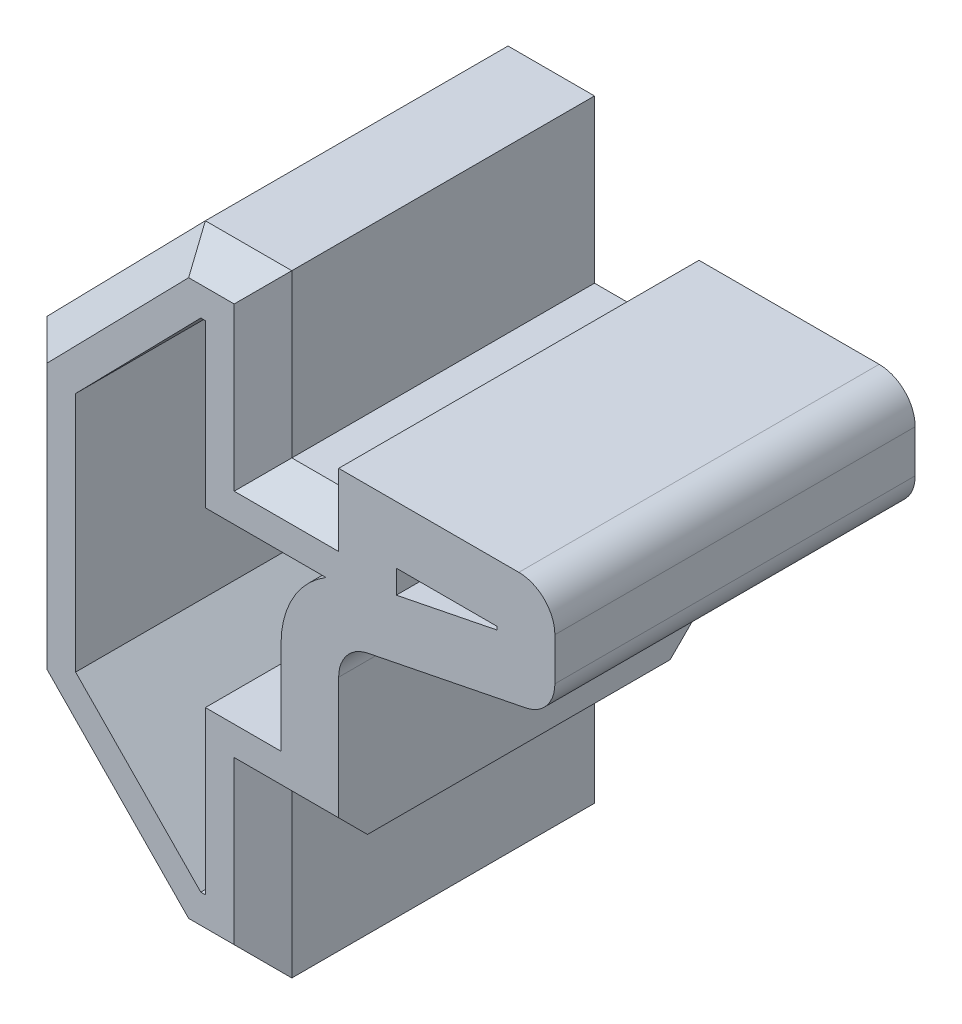
from build123d import *

# Parameters (mm, degrees)
SALIENTE_EXTRUIR1_DEPTH = 5
SALIENTE_EXTRUIR2_DEPTH = 10
REDONDEO1_R             = 1
VACIADO1_START          = -5
VACIADO1_DEPTH          = 10
CHAFL_N1_SIZE           = 0.8


# Read off the part's stored shape, not the designer's step: Vaciado1
with BuildPart() as part:
    # Croquis1 → Saliente-Extruir1 (new, symmetric)
    with BuildSketch(Plane.XY):
        Polygon((0, 4), (-2.1, 4), (-2.1, 8.5), (-4.5, 8.5), (-8.9, 4), (-8.9, -4), (-4.5, -8.5), (-2.1, -8.5), (-2.1, -4), (0, -4), align=None)
    extrude(amount=SALIENTE_EXTRUIR1_DEPTH, both=True)

    # Croquis2 → Saliente-Extruir2 (add, through all)
    with BuildSketch(Plane(origin=(0, 0, -5), x_dir=(-1, 0, 0), z_dir=(0, 0, -1))):
        Polygon((0, 4), (0, 5.2), (-6, 5.2), (-6, 2.2), (0, 1), align=None)
    extrude(amount=-SALIENTE_EXTRUIR2_DEPTH)

    # Redondeo1
    redondeo1_edges = [part.edges().sort_by_distance(p)[0] for p in [
        (0, 1, 0),
        (6, 2.2, 0),
        (6, 5.2, 0),
    ]]
    fillet(redondeo1_edges, radius=REDONDEO1_R)

    # Vaciado1 outline → Vaciado1 (cut)
    with BuildSketch(Plane.XY.offset(VACIADO1_START)):
        Polygon((4.4, 3.511686244), (4.4, 3.6), (1.6, 3.6), (1.6, 2.951686244), align=None)
        with BuildLine():
            Line((-1.6, -2.4), (-1.6, 0.180196097))
            ThreePointArc((-1.6, 0.180196097), (-1.267111406, 1.453069175), (-0.35368779, 2.4))
            Line((-0.35368779, 2.4), (-3.7, 2.4))
            Line((-3.7, 2.4), (-3.7, 6.9))
            Line((-3.7, 6.9), (-3.826703079, 6.9))
            Line((-3.826703079, 6.9), (-7.3, 3.347764512))
            Line((-7.3, 3.347764512), (-7.3, -3.347764512))
            Line((-7.3, -3.347764512), (-3.826703079, -6.9))
            Line((-3.826703079, -6.9), (-3.7, -6.9))
            Line((-3.7, -6.9), (-3.7, -2.4))
            Line((-3.7, -2.4), (-1.6, -2.4))
        make_face()
    extrude(amount=VACIADO1_DEPTH, mode=Mode.SUBTRACT)

    # Chaflán1
    chafl_n1_edges = [part.edges().sort_by_distance(p)[0] for p in [
        (-1.05, -4, -5),
        (-2.1, -6.25, -5),
        (-3.3, -8.5, -5),
        (-6.7, -6.25, -5),
        (-8.9, 0, -5),
        (-6.7, 6.25, -5),
        (-3.3, 8.5, -5),
        (-2.1, 6.25, 5),
        (-2.1, 6.25, -5),
        (-1.05, 4, -5),
        (-3.3, 8.5, 5),
        (-6.7, 6.25, 5),
        (-8.9, 0, 5),
        (-6.7, -6.25, 5),
        (-3.3, -8.5, 5),
        (-2.1, -6.25, 5),
        (-1.05, -4, 5),
        (-1.05, 4, 5),
    ]]
    chamfer(chafl_n1_edges, length=CHAFL_N1_SIZE)


solid = part.part
